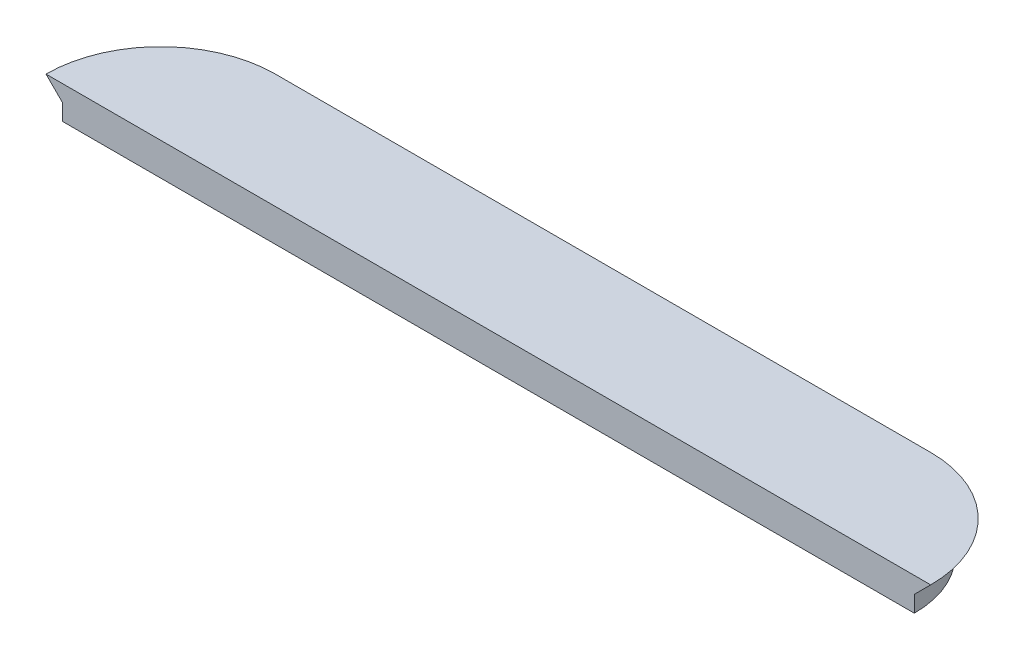
from build123d import *

# Parameters (mm, degrees)
BOSS_EXTRUDE1_DEPTH = 2.5
SKETCH3_W           = 50
SKETCH3_H           = 1.25
CUT_EXTRUDE2_DEPTH  = 1.25
CHAMFER2_SIZE       = 1.25


with BuildPart() as part:
    # Sketch1 → Boss-Extrude1 (new body)
    with BuildSketch(Plane(origin=(0, 0, 0), x_dir=(1, 0, 0), z_dir=(0, 1, 0))):
        with BuildLine():
            Line((0, 0), (-8.75, 0))
            ThreePointArc((-8.75, 0), (-6.187184335, 6.187184335), (0, 8.75))
            Line((0, 8.75), (50, 8.75))
            ThreePointArc((50, 8.75), (56.187184335, 6.187184335), (58.75, 0))
            Line((58.75, 0), (50, 0))
            Line((50, 0), (0, 0))
        make_face()
    extrude(amount=BOSS_EXTRUDE1_DEPTH)

    # Sketch3 → Cut-Extrude2 (cut)
    with BuildSketch(Plane.XZ):
        with BuildLine():
            Line((58.75, 0), (57.5, 0))
            ThreePointArc((57.5, 0), (55.303300859, -5.303300859), (50, -7.5))
            Line((50, -7.5), (50, -8.75))
            ThreePointArc((50, -8.75), (56.187184335, -6.187184335), (58.75, 0))
        make_face()
        with Locations((25, -8.125)):
            Rectangle(SKETCH3_W, SKETCH3_H)
        with BuildLine():
            Line((-7.5, 0), (-8.75, 0))
            ThreePointArc((-8.75, 0), (-6.187184335, -6.187184335), (0, -8.75))
            Line((0, -8.75), (0, -7.5))
            ThreePointArc((0, -7.5), (-5.303300859, -5.303300859), (-7.5, 0))
        make_face()
    extrude(amount=-CUT_EXTRUDE2_DEPTH, mode=Mode.SUBTRACT)

    # Chamfer2
    chamfer2_edges = [part.edges().sort_by_distance(p)[0] for p in [
        (56.187184335, 1.25, -6.187184335),
        (25, 1.25, -8.75),
        (-6.187184335, 1.25, -6.187184335),
    ]]
    chamfer(chamfer2_edges, length=CHAMFER2_SIZE - 0.0001)  # a hair under: the kernel refuses the full size


solid = part.part
